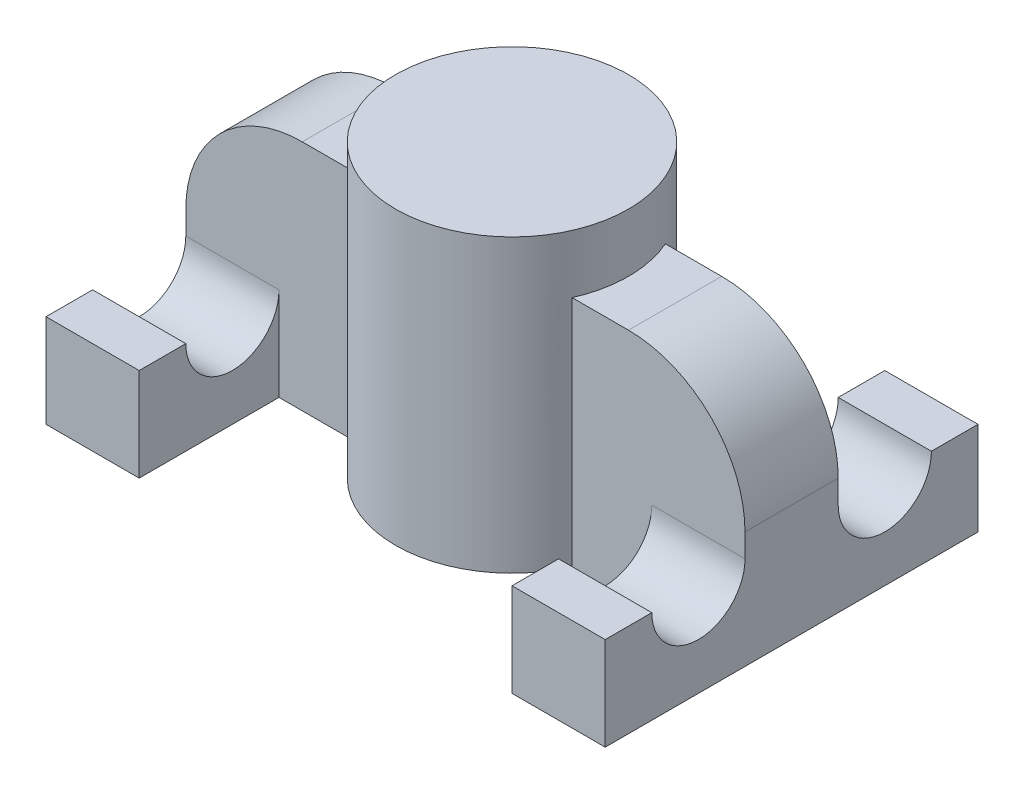
from build123d import *

# Parameters (mm, degrees)
SKETCH1_R                = 10
PEN_CAP_DEPTH            = 25
SKETCH2_W                = 48
SKETCH2_H                = 8
HOOK_STRUCTURE_DEPTH     = 20
PEN_CENTERING_HOLE_D     = 11
PEN_CENTERING_HOLE_DEPTH = 15
PEN_CENTERING_HOLE_TIP   = 5.5
HOOKS_DEPTH              = 8
CORNER_DEC_R             = 10


with BuildPart() as part:
    # Sketch1 → Pen Cap (new body)
    with BuildSketch(Plane(origin=(0, 0, 0), x_dir=(1, 0, 0), z_dir=(0, 1, 0))):
        Circle(SKETCH1_R)
    extrude(amount=PEN_CAP_DEPTH)

    # Sketch2 → Hook Structure (add)
    with BuildSketch(Plane.XZ):
        Rectangle(SKETCH2_W, SKETCH2_H)
    extrude(amount=-HOOK_STRUCTURE_DEPTH)

    # Pen Centering Hole
    with Locations(Plane.XZ):
        with Locations((0, 0)):
            Hole(PEN_CENTERING_HOLE_D / 2, depth=PEN_CENTERING_HOLE_DEPTH)
            with Locations((0, 0, -(PEN_CENTERING_HOLE_DEPTH + PEN_CENTERING_HOLE_TIP / 2))):  # 90° drill point
                Cone(0, PEN_CENTERING_HOLE_D / 2, PEN_CENTERING_HOLE_TIP, mode=Mode.SUBTRACT)

    # Sketch6 → Hooks (add)
    with BuildSketch(Plane(origin=(24, 0, 0), x_dir=(0, 0, -1), z_dir=(1, 0, 0))):
        with BuildLine():
            Line((-4, 0), (-16, 0))
            Line((-16, 0), (-16, 8))
            Line((-16, 8), (-12, 8))
            ThreePointArc((-12, 8), (-8, 4), (-4, 8))
            Line((-4, 8), (-4, 0))
        make_face()
        with BuildLine():
            Line((4, 8), (4, 0))
            Line((4, 0), (16, 0))
            Line((16, 0), (16, 8))
            Line((16, 8), (12, 8))
            ThreePointArc((12, 8), (8, 4), (4, 8))
        make_face()
    hooks = extrude(amount=-HOOKS_DEPTH)

    # Hook Mirror: Hooks across plane
    add(hooks.mirror(Plane(origin=(0, 0, 0), x_dir=(0, 0, 1), z_dir=(1, 0, 0))))

    # Corner Dec
    corner_dec_edges = [part.edges().sort_by_distance(p)[0] for p in [
        (24, 20, 0),
        (-24, 20, 0),
    ]]
    fillet(corner_dec_edges, radius=CORNER_DEC_R)


solid = part.part
